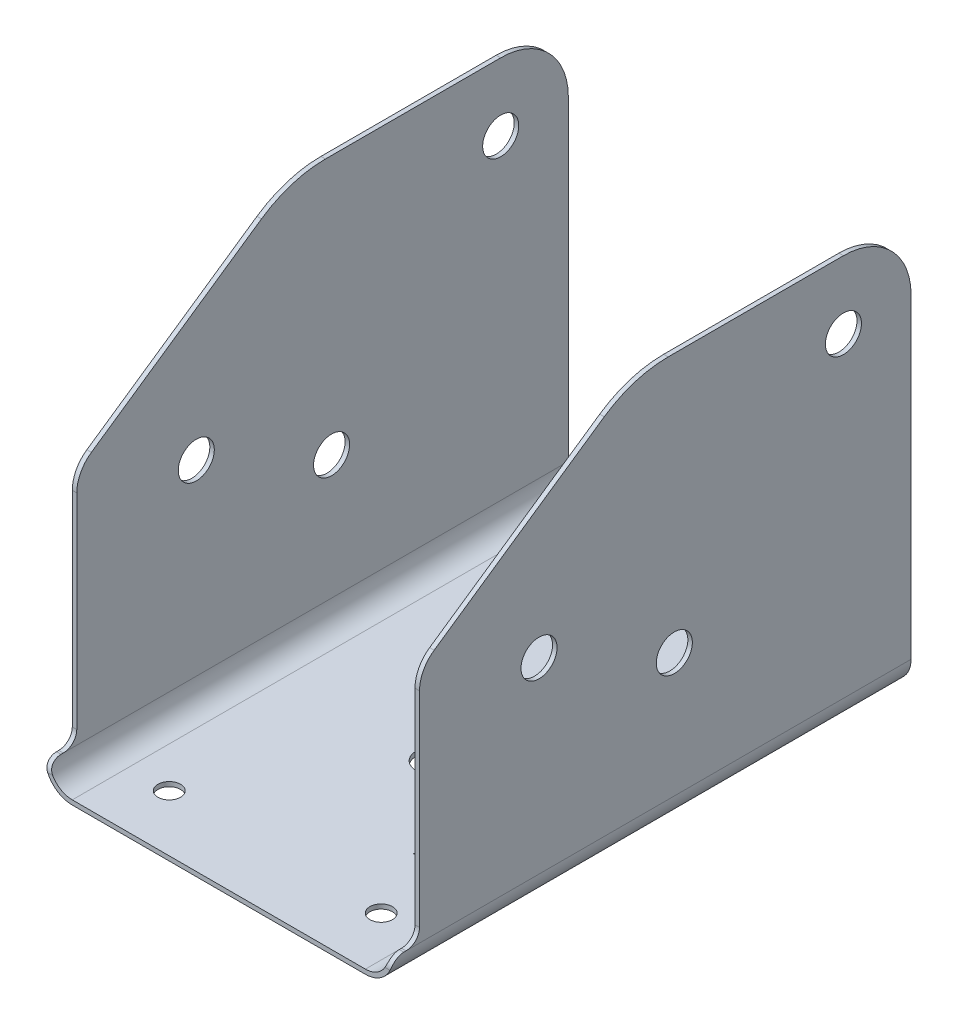
from build123d import *

# Parameters (mm, degrees)
SKETCH1_W                      = 150
SKETCH1_H                      = 230
BASE_FLANGE1_DEPTH             = 2
EDGE_FLANGE1_STRIP_W           = 28
EDGE_FLANGE1_STRIP_H           = 2
EDGE_FLANGE1_STRIP_CUT_DEPTH   = 230
EDGE_FLANGE1_STRIP_2_W         = 28
EDGE_FLANGE1_STRIP_2_H         = 2
EDGE_FLANGE1_STRIP_CUT_2_DEPTH = 230
EDGE_FLANGE1_DEPTH             = 230
EDGE_FLANGE1_BEND_DEPTH        = 230
SKETCH15_OUTSIDE_W             = 298.254
SKETCH15_OUTSIDE_H             = 250.254
SKETCH15_OUTSIDE_R             = 8
CUT_EXTRUDE1_DEPTH             = 264.326793168
SKETCH16_R                     = 5
CUT_EXTRUDE2_DEPTH             = 228.055059487
CUT_EXTRUDE3_DEPTH             = 228.055059487
SKETCHED_START                 = 47
SKETCHED_BEND1_DEPTH           = 11.052994728
SKETCHED_BEND1_2_DEPTH         = 11.052994728
CUT_EXTRUDE4_REACH             = 241.866
SKETCH20_R                     = 1.25


# Read off the part's stored shape, not the designer's step: Sketched Bend1
# Sheet-metal steps are written as plain solids
with BuildPart() as part:
    # Sketch1 → Base-Flange1 (new body)
    with BuildSketch(Plane(origin=(0, 0, 0), x_dir=(1, 0, 0), z_dir=(0, 1, 0))):
        Rectangle(SKETCH1_W, SKETCH1_H)
    extrude(amount=-BASE_FLANGE1_DEPTH)

    # Edge-Flange1 strip (across the edge) → Edge-Flange1 strip cut (cut)
    with BuildSketch(Plane(origin=(75, 0, 115), x_dir=(-1, 0, 0), z_dir=(0, 0, -1))):
        with Locations((-4, -1)):
            Rectangle(EDGE_FLANGE1_STRIP_W, EDGE_FLANGE1_STRIP_H)
    extrude(amount=EDGE_FLANGE1_STRIP_CUT_DEPTH, mode=Mode.SUBTRACT)

    # Edge-Flange1 strip 2 (across the edge) → Edge-Flange1 strip cut 2 (cut)
    with BuildSketch(Plane(origin=(-75, 0, -115), x_dir=(1, 0, 0), z_dir=(0, 0, 1))):
        with Locations((-4, -1)):
            Rectangle(EDGE_FLANGE1_STRIP_2_W, EDGE_FLANGE1_STRIP_2_H)
    extrude(amount=EDGE_FLANGE1_STRIP_CUT_2_DEPTH, mode=Mode.SUBTRACT)

    # Edge-Flange1 section (across the edge) → Edge-Flange1 (add)
    with BuildSketch(Plane(origin=(75, 0, 115), x_dir=(-1, 0, 0), z_dir=(0, 0, -1))):
        with BuildLine():
            Line((-2, 10), (-2, 180))
            Line((-2, 180), (0, 180))
            Line((0, 180), (0, 10))
            ThreePointArc((0, 10), (2.928932188, 2.928932188), (10, 0))
            Line((10, 0), (10, -2))
            ThreePointArc((10, -2), (1.514718626, 1.514718626), (-2, 10))
        make_face()
    extrude(amount=EDGE_FLANGE1_DEPTH)

    # Edge-Flange1 section 2 (across the edge) → Edge-Flange1 bend (add)
    with BuildSketch(Plane(origin=(-75, 0, -115), x_dir=(1, 0, 0), z_dir=(0, 0, 1))):
        with BuildLine():
            Line((-2, 10), (-2, 180))
            Line((-2, 180), (0, 180))
            Line((0, 180), (0, 10))
            ThreePointArc((0, 10), (2.928932188, 2.928932188), (10, 0))
            Line((10, 0), (10, -2))
            ThreePointArc((10, -2), (1.514718626, 1.514718626), (-2, 10))
        make_face()
    extrude(amount=EDGE_FLANGE1_BEND_DEPTH)

    # Sketch15 outside → Cut-Extrude1 (cut, through all)
    # profile 1 of 4: a face of its own
    with BuildSketch(Plane.ZY.offset(77)):
        with Locations((0, 89)):
            Rectangle(SKETCH15_OUTSIDE_W, SKETCH15_OUTSIDE_H)
        with BuildLine():
            Line((21.083470393, 171.180744276), (96.507242037, 119.243178795))
            ThreePointArc((96.507242037, 119.243178795), (101.277963521, 113.867184852), (103, 106.888955512))
            Line((103, 106.888955512), (103, 16))
            ThreePointArc((103, 16), (104.757359313, 11.757359313), (109, 10))
            Line((109, 10), (110, 10))
            ThreePointArc((110, 10), (113.535533906, 8.535533906), (115, 5))
            Line((115, 5), (115, -2))
            Line((115, -2), (-115, -2))
            Line((-115, -2), (-115, 99))
            Line((-115, 99), (-115, 150))
            ThreePointArc((-115, 150), (-106.213203436, 171.213203436), (-85, 180))
            Line((-85, 180), (-49, 180))
            Line((-49, 180), (-7.274003064, 180))
            ThreePointArc((-7.274003064, 180), (7.574612801, 177.744304445), (21.083470393, 171.180744276))
        make_face(mode=Mode.SUBTRACT)
    # profile 2 of 4: a face of its own
    with BuildSketch(Plane.ZY.offset(77)):
        with Locations(Location((50, 93, 0), (0, 0, 270))):
            Circle(SKETCH15_OUTSIDE_R)
    # profile 3 of 4: a face of its own
    with BuildSketch(Plane.ZY.offset(77)):
        with Locations(Location((-85, 150, 0), (0, 0, 270))):
            Circle(SKETCH15_OUTSIDE_R)
    # profile 4 of 4: a face of its own
    with BuildSketch(Plane.ZY.offset(77)):
        with Locations(Location((-10, 65, 0), (0, 0, 270))):
            Circle(SKETCH15_OUTSIDE_R)
    extrude(amount=-CUT_EXTRUDE1_DEPTH, mode=Mode.SUBTRACT)

    # Sketch16 → Cut-Extrude2 (cut, through all)
    with BuildSketch(Plane(origin=(0, 0, 0), x_dir=(1, 0, 0), z_dir=(0, 1, 0))):
        with Locations(Location((-47, 90, 0), (0, 0, 270))):
            Circle(SKETCH16_R)
        with Locations(Location((47, 90, 0), (0, 0, 90))):
            Circle(SKETCH16_R)
        with Locations(Location((47, -90, 0), (0, 0, 270))):
            Circle(SKETCH16_R)
        with Locations(Location((-47, -90, 0), (0, 0, 90))):
            Circle(SKETCH16_R)
        with BuildLine():
            Line((7.5, 20), (7.5, -20))
            ThreePointArc((7.5, -20), (0, -27.5), (-7.5, -20))
            Line((-7.5, -20), (-7.5, 20))
            ThreePointArc((-7.5, 20), (0, 27.5), (7.5, 20))
        make_face()
    extrude(amount=-CUT_EXTRUDE2_DEPTH, mode=Mode.SUBTRACT)

    # Sketch18 → Cut-Extrude3 (cut, through all)
    with BuildSketch(Plane(origin=(0, 0, 0), x_dir=(1, 0, 0), z_dir=(0, 1, 0))):
        Polygon((31.4, -45), (44.4, -45), (44.4, -60.052994728), (31.4, -60.052994728), (31.4, -58.052994728), (42.4, -58.052994728), (42.4, -47), (31.4, -47), align=None)
    extrude(amount=-CUT_EXTRUDE3_DEPTH, mode=Mode.SUBTRACT)

    # Sketched Bend1 outline → Sketched Bend1 (cut)
    with BuildSketch(Plane.XY.offset(SKETCHED_START)):
        with BuildLine():
            ThreePointArc((34.035602398, 0), (33.054267209, -1.443395312), (31.4, -2))
            Line((31.4, -2), (42.4, -2))
            Line((42.4, -2), (42.4, 0))
            Line((42.4, 0), (34.035602398, 0))
        make_face()
    extrude(amount=SKETCHED_BEND1_DEPTH, mode=Mode.SUBTRACT)

    # Sketched Bend1 2 outline → Sketched Bend1 2 (add)
    with BuildSketch(Plane.XY.offset(SKETCHED_START)):
        with BuildLine():
            Line((31.4, 0), (34.035602398, 0))
            ThreePointArc((34.035602398, 0), (34.111233029, 0.364854094), (34.1366, 0.7366))
            Line((34.1366, 0.7366), (34.1366, 9.008755099))
            Line((34.1366, 9.008755099), (32.1366, 9.008755099))
            Line((32.1366, 9.008755099), (32.1366, 0.7366))
            ThreePointArc((32.1366, 0.7366), (31.920854855, 0.215745145), (31.4, 0))
        make_face()
    extrude(amount=SKETCHED_BEND1_2_DEPTH)

    # Sketch20 → Cut-Extrude4 (cut, up to next)
    with BuildSketch(Plane.ZY.offset(-32.1366), mode=Mode.PRIVATE) as cut_extrude4_sk1:
        with Locations(Location((52.526497364, 4.9366, 0), (0, 0, 270))):
            Circle(SKETCH20_R)
    cut_extrude4_tool1 = extrude(cut_extrude4_sk1.sketch, amount=-CUT_EXTRUDE4_REACH, mode=Mode.PRIVATE) & part.part
    add(cut_extrude4_tool1.solids().sort_by_distance((32.1366, 4.9366, 52.526497))[0], mode=Mode.SUBTRACT)


solid = part.part
